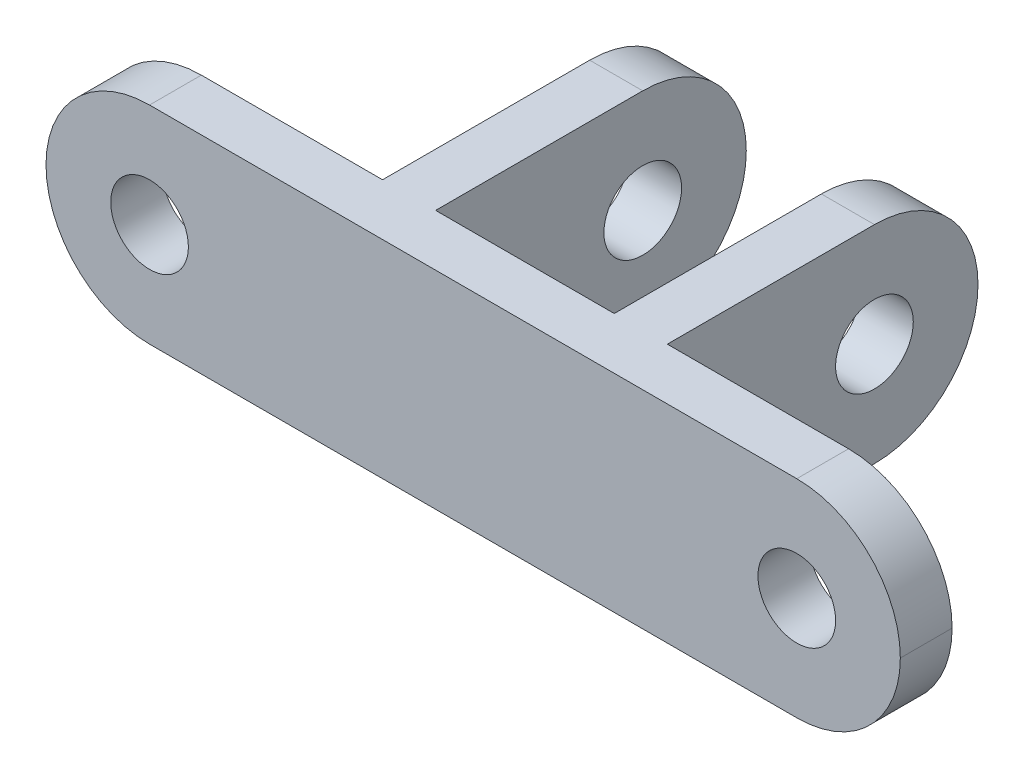
from build123d import *

# Parameters (mm, degrees)
SKETCH_1_W          = 33
SKETCH_1_H          = 14
EXTRUDE_1_DEPTH     = 8
SKETCH_2_W          = 11
SKETCH_2_H          = 12
SKETCH_2_W_2        = 6.9
CUT_EXTRUDE_1_DEPTH = 20.627786426
FILLET_1_R          = 4
FILLET_2_R          = 4
SKETCH_3_R          = 1.5
CUT_EXTRUDE_2_DEPTH = 11
SKETCH_4_R          = 1.5
CUT_EXTRUDE_3_DEPTH = 24.07054399


with BuildPart() as part:
    # 草图1 → 凸台-拉伸1 (new body)
    with BuildSketch(Plane(origin=(0, 0, 0), x_dir=(1, 0, 0), z_dir=(0, 1, 0))):
        Rectangle(SKETCH_1_W, SKETCH_1_H)
    extrude(amount=EXTRUDE_1_DEPTH)

    # 草图2 → 切除-拉伸1 (cut, through all)
    with BuildSketch(Plane(origin=(0, 8, 0), x_dir=(1, 0, 0), z_dir=(0, 1, 0))):
        with Locations((-11, 1)):
            Rectangle(SKETCH_2_W, SKETCH_2_H)
        with Locations((11, 1)):
            Rectangle(SKETCH_2_W, SKETCH_2_H)
        with Locations((0, 1)):
            Rectangle(SKETCH_2_W_2, SKETCH_2_H)
    extrude(amount=-CUT_EXTRUDE_1_DEPTH, mode=Mode.SUBTRACT)

    # 圆角1
    fillet_1_edges = [part.edges().sort_by_distance(p)[0] for p in [
        (16.5, 0, 6),
        (16.5, 8, 6),
        (-16.5, 0, 6),
        (-16.5, 8, 6),
    ]]
    fillet(fillet_1_edges, radius=FILLET_1_R - 0.0001)  # a hair under: the kernel refuses the full size

    # 圆角2
    fillet_2_edges = [part.edges().sort_by_distance(p)[0] for p in [
        (-4.475, 8, -7),
        (-4.475, 0, -7),
        (4.475, 0, -7),
        (4.475, 8, -7),
    ]]
    fillet(fillet_2_edges, radius=FILLET_2_R - 0.0001)  # a hair under: the kernel refuses the full size

    # 草图3 → 切除-拉伸2 (cut)
    with BuildSketch(Plane(origin=(5.5, 0, 0), x_dir=(0, 0, -1), z_dir=(1, 0, 0))):
        with Locations((3, 4)):
            Circle(SKETCH_3_R)
    extrude(amount=-CUT_EXTRUDE_2_DEPTH, mode=Mode.SUBTRACT)

    # 草图4 → 切除-拉伸3 (cut, through all)
    with BuildSketch(Plane.XY.offset(7)):
        with Locations((12.5, 4)):
            Circle(SKETCH_4_R)
        with Locations((-12.5, 4)):
            Circle(SKETCH_4_R)
    extrude(amount=-CUT_EXTRUDE_3_DEPTH, mode=Mode.SUBTRACT)


solid = part.part
